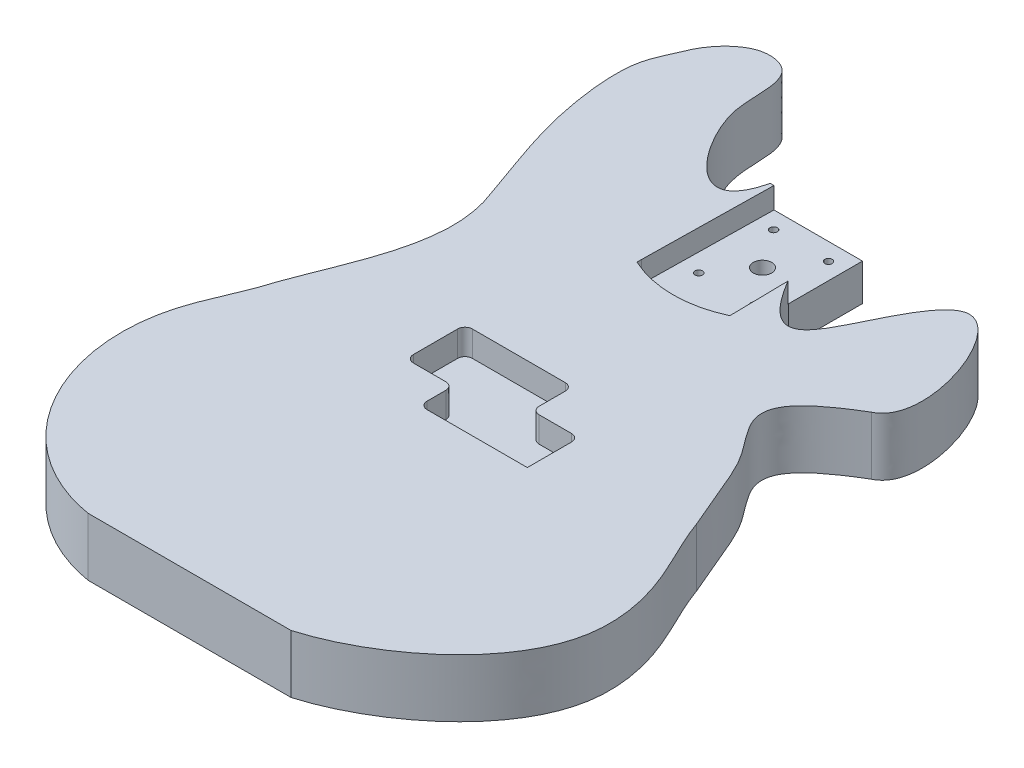
from build123d import *

# Parameters (mm, degrees)
BOSS_EXTRUDE1_DEPTH = 40.005
CUT_EXTRUDE1_DEPTH  = 14.605
SKETCH3_R           = 6.35
SKETCH3_R_2         = 2.54
CUT_EXTRUDE2_DEPTH  = 539.066679286
CUT_EXTRUDE3_DEPTH  = 17.5514


with BuildPart() as part:
    # Sketch1 → Boss-Extrude1 (new body)
    with BuildSketch(Plane(origin=(0, 0, 0), x_dir=(1, 0, 0), z_dir=(0, 1, 0))):
        with BuildLine():
            Line((-31.75, 431.8), (31.75, 431.8))
            Line((31.75, 431.8), (31.75, 381))
            add(Edge.make_bspline(
                [(139.7, 330.2), (166.445933937, 342.89199921), (123.503776034, 464.530793204), (76.812686628, 369.38946014), (59.509313942, 333.666820551), (31.75, 381)],
                knots=[0, 0, 0, 0, 0.451982316, 0.679896033, 1, 1, 1, 1], degree=3))
            add(Edge.make_bspline(
                [(146.05, 203.2), (136.159858324, 225.650446788), (132.589610525, 236.847424982), (120.383558334, 260.933031596), (109.568716266, 273.359552136), (96.590167779, 297.02427137), (109.096273913, 311.992671669), (139.7, 330.2)],
                knots=[0, 0, 0, 0, 0.338979618, 0.396393174, 0.554386404, 0.616722002, 1, 1, 1, 1], degree=3))
            add(Edge.make_bspline(
                [(69.85, 0), (111.934817577, 12.111106324), (186.014505262, 65.749693466), (170.841604559, 155.498343774), (152.338106065, 185.626315347), (146.05, 203.2)],
                knots=[0, 0, 0, 0, 0.586136039, 0.784814246, 1, 1, 1, 1], degree=3))
            Line((69.85, 0), (-69.85, 0))
            add(Edge.make_bspline(
                [(-69.85, 0), (-122.745853908, 8.894627237), (-170.373818617, 68.373598191), (-165.531190573, 154.759290659), (-147.834713243, 185.810503286), (-142.875, 203.2)],
                knots=[0, 0, 0, 0, 0.581043163, 0.78383742, 1, 1, 1, 1], degree=3))
            add(Edge.make_bspline(
                [(-142.875, 203.2), (-128.639770906, 243.099083108), (-104.490445622, 285.950192917), (-122.2248, 330.2)],
                knots=[0, 0, 0, 0, 1, 1, 1, 1], degree=3))
            add(Edge.make_bspline(
                [(-122.2248, 330.2), (-131.763508886, 357.856604277), (-146.2425508, 392.351504834), (-152.772633421, 455.278086227), (-144.543275129, 471.013225285), (-135.470443556, 492.861244858), (-120.651127827, 508.750910027), (-90.829721956, 507.317797539), (-88.364588713, 481.720202384), (-88.704714068, 444.441923985), (-43.011483466, 384.645662013), (-31.75, 431.8)],
                knots=[0, 0, 0, 0, 0.228270644, 0.373680854, 0.455314812, 0.473381506, 0.54535154, 0.564858815, 0.659457996, 0.74420055, 1, 1, 1, 1], degree=3))
        make_face()
    extrude(amount=BOSS_EXTRUDE1_DEPTH)

    # Sketch2 → Cut-Extrude1 (cut)
    with BuildSketch(Plane(origin=(0, 40.005, 0), x_dir=(1, 0, 0), z_dir=(0, 1, 0))):
        with BuildLine():
            Line((-29.21, 431.8), (31.75, 431.8))
            Line((31.75, 431.8), (33.2232, 341.9475))
            Line((33.2232, 341.9475), (33.2232, 338.8995))
            ThreePointArc((33.2232, 338.8995), (1.27, 331.7875), (-30.6832, 338.8995))
            Line((-30.6832, 338.8995), (-30.6832, 341.9475))
            Line((-30.6832, 341.9475), (-29.21, 431.8))
        make_face()
    extrude(amount=-CUT_EXTRUDE1_DEPTH, mode=Mode.SUBTRACT)

    # Sketch3 → Cut-Extrude2 (cut, through all)
    with BuildSketch(Plane(origin=(0, 25.4, 0), x_dir=(1, 0, 0), z_dir=(0, 1, 0))):
        with Locations((1.27, 393.3952)):
            Circle(SKETCH3_R)
        with Locations((-17.526, 419.862)):
            Circle(SKETCH3_R_2)
        with Locations((20.2692, 419.862)):
            Circle(SKETCH3_R_2)
        with Locations((20.59715074, 368.3)):
            Circle(SKETCH3_R_2)
        with Locations((-17.549082464, 368.3)):
            Circle(SKETCH3_R_2)
    extrude(amount=-CUT_EXTRUDE2_DEPTH, mode=Mode.SUBTRACT)

    # Sketch4 → Cut-Extrude3 (cut)
    with BuildSketch(Plane(origin=(0, 40.005, 0), x_dir=(1, 0, 0), z_dir=(0, 1, 0))):
        with BuildLine():
            Line((-47.498, 242.316), (16.51, 242.316))
            ThreePointArc((16.51, 242.316), (20.102102448, 240.828102448), (21.59, 237.236))
            Line((21.59, 237.236), (21.59, 219.202))
            ThreePointArc((21.59, 219.202), (23.077897552, 215.609897552), (26.67, 214.122))
            Line((26.67, 214.122), (49.022, 214.122))
            ThreePointArc((49.022, 214.122), (52.614102448, 212.634102448), (54.102, 209.042))
            Line((54.102, 209.042), (54.102, 178.562))
            Line((54.102, 178.562), (-14.986, 178.562))
            ThreePointArc((-14.986, 178.562), (-18.578102448, 180.049897552), (-20.066, 183.642))
            Line((-20.066, 183.642), (-20.066, 196.596))
            ThreePointArc((-20.066, 196.596), (-21.553897552, 200.188102448), (-25.146, 201.676))
            Line((-25.146, 201.676), (-47.498, 201.676))
            ThreePointArc((-47.498, 201.676), (-51.090102448, 203.163897552), (-52.578, 206.756))
            Line((-52.578, 206.756), (-52.578, 237.236))
            ThreePointArc((-52.578, 237.236), (-51.090102448, 240.828102448), (-47.498, 242.316))
        make_face()
    extrude(amount=-CUT_EXTRUDE3_DEPTH, mode=Mode.SUBTRACT)


solid = part.part
